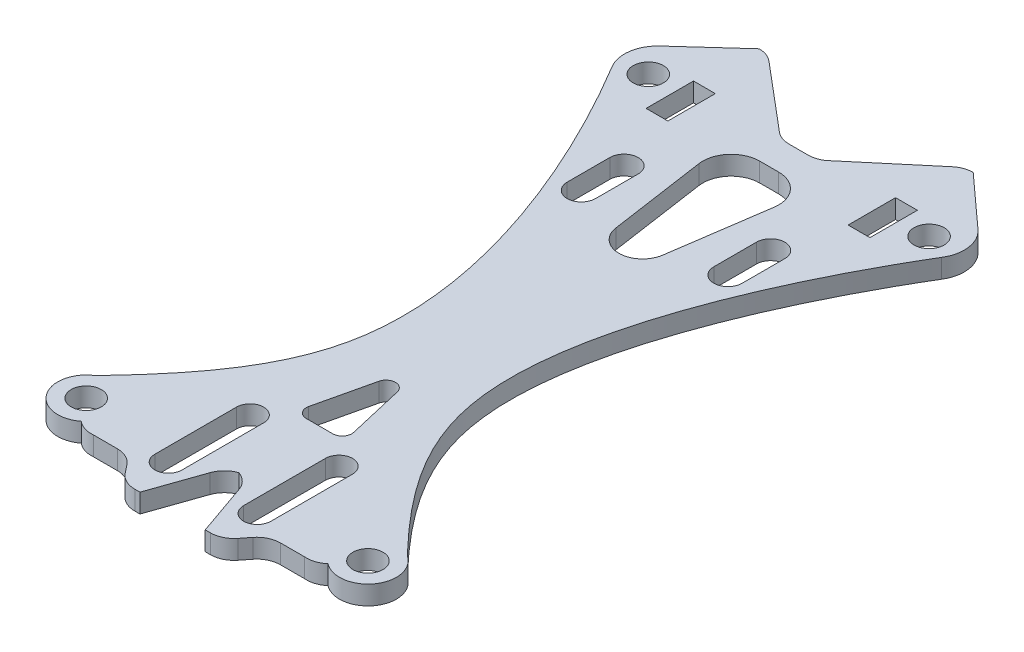
from build123d import *

# Parameters (mm, degrees)
CROQUIS1_R              = 1.5875
CROQUIS1_W              = 2.3
CROQUIS1_H              = 5
SALIENTE_EXTRUIR2_DEPTH = 2


with BuildPart() as part:
    # Croquis1 → Saliente-Extruir2 (new body)
    with BuildSketch(Plane(origin=(0, 0, 0), x_dir=(1, 0, 0), z_dir=(0, 1, 0))):
        with BuildLine():
            Line((-16.762987127, 33.41807474), (-11.286730499, 38.387118929))
            ThreePointArc((-11.286730499, 38.387118929), (-10.420900247, 38.238338665), (-9.659998874, 37.799218302))
            Line((-9.659998874, 37.799218302), (-2.763051086, 31.989574312))
            ThreePointArc((-2.763051086, 31.989574312), (-1.95542878, 31.454802741), (-1.00515352, 31.267155856))
            Line((-1.00515352, 31.267155856), (-0.040723182, 31.267155856))
            Line((-0.040723182, 31.267155856), (0.040723182, 31.267155856))
            Line((0.040723182, 31.267155856), (1.00515352, 31.267155856))
            ThreePointArc((1.00515352, 31.267155856), (1.95542878, 31.454802741), (2.763051086, 31.989574312))
            Line((2.763051086, 31.989574312), (9.659998874, 37.799218302))
            ThreePointArc((9.659998874, 37.799218302), (10.420900247, 38.238338665), (11.286730499, 38.387118929))
            Line((11.286730499, 38.387118929), (16.762987127, 33.41807474))
            ThreePointArc((16.762987127, 33.41807474), (17.879398464, 31.295802238), (17.367697595, 28.953031002))
            add(Edge.make_bspline(
                [(16.468171907, -26.453354129), (11.118055328, -20.880037637), (-0.475190064, -5.25871988), (11.98227146, 19.992839151), (17.367697595, 28.953031002)],
                knots=[0, 0, 0, 0, 0.325398162, 1, 1, 1, 1], degree=3))
            ThreePointArc((16.468171907, -26.453354129), (17.297467492, -30.714428288), (13.002178368, -31.342899047))
            ThreePointArc((13.002178368, -31.342899047), (12.132213174, -31.835753002), (11.138692552, -31.948275137))
            Line((11.138692552, -31.948275137), (8.598739942, -31.948275137))
            ThreePointArc((8.598739942, -31.948275137), (7.506720993, -32.19938772), (6.634077803, -32.902279446))
            Line((6.634077803, -32.902279446), (5.953226574, -33.767509951))
            ThreePointArc((5.953226574, -33.767509951), (5.080583384, -34.470401676), (3.988564435, -34.721514259))
            Line((3.988564435, -34.721514259), (3.441216411, -34.721514259))
            Line((3.441216411, -34.721514259), (1.533856825, -29.262119003))
            ThreePointArc((1.533856825, -29.262119003), (0.942151005, -28.319542636), (0, -27.727159764))
            ThreePointArc((0, -27.727159764), (-0.942151005, -28.319542636), (-1.533856825, -29.262119003))
            Line((-1.533856825, -29.262119003), (-3.441216411, -34.721514259))
            Line((-3.441216411, -34.721514259), (-3.988564435, -34.721514259))
            ThreePointArc((-3.988564435, -34.721514259), (-5.080583384, -34.470401676), (-5.953226574, -33.767509951))
            Line((-5.953226574, -33.767509951), (-6.634077803, -32.902279446))
            ThreePointArc((-6.634077803, -32.902279446), (-7.506720993, -32.19938772), (-8.598739942, -31.948275137))
            Line((-8.598739942, -31.948275137), (-11.138692552, -31.948275137))
            ThreePointArc((-11.138692552, -31.948275137), (-12.132213174, -31.835753002), (-13.002178368, -31.342899047))
            ThreePointArc((-13.002178368, -31.342899047), (-17.297467492, -30.714428288), (-16.468171907, -26.453354129))
            add(Edge.make_bspline(
                [(-16.468171907, -26.453354129), (-11.118055328, -20.880037637), (0.475190064, -5.25871988), (-11.98227146, 19.992839151), (-17.367697595, 28.953031002)],
                knots=[0, 0, 0, 0, 0.325398162, 1, 1, 1, 1], degree=3))
            ThreePointArc((-17.367697595, 28.953031002), (-17.879398464, 31.295802238), (-16.762987127, 33.41807474))
        make_face()
        with Locations((-14.85, -28.979521122)):
            Circle(CROQUIS1_R, mode=Mode.SUBTRACT)
        with Locations((14.85, -28.979521122)):
            Circle(CROQUIS1_R, mode=Mode.SUBTRACT)
        with Locations((-14.8, 30.22394451)):
            Circle(CROQUIS1_R, mode=Mode.SUBTRACT)
        with Locations((14.8, 30.22394451)):
            Circle(CROQUIS1_R, mode=Mode.SUBTRACT)
        with BuildLine():
            Line((-3.249732449, -21.867659367), (-3.249732449, -30.47604675))
            ThreePointArc((-3.249732449, -30.47604675), (-4.684765235, -31.911079536), (-6.119798022, -30.47604675))
            Line((-6.119798022, -30.47604675), (-6.119798022, -21.867659367))
            ThreePointArc((-6.119798022, -21.867659367), (-4.684765235, -20.432626581), (-3.249732449, -21.867659367))
        make_face(mode=Mode.SUBTRACT)
        with BuildLine():
            Line((-1.39382162, -19.231382002), (1.39382162, -19.231382002))
            ThreePointArc((1.39382162, -19.231382002), (2.176853635, -18.853363403), (2.367884319, -18.005103727))
            Line((2.367884319, -18.005103727), (0.974062699, -12.005103727))
            ThreePointArc((0.974062699, -12.005103727), (0, -11.231382002), (-0.974062699, -12.005103727))
            Line((-0.974062699, -12.005103727), (-2.367884319, -18.005103727))
            ThreePointArc((-2.367884319, -18.005103727), (-2.176853635, -18.853363403), (-1.39382162, -19.231382002))
        make_face(mode=Mode.SUBTRACT)
        with BuildLine():
            Line((-6.229263844, 20.592791948), (-6.229263844, 16.095612647))
            ThreePointArc((-6.229263844, 16.095612647), (-7.728593009, 14.596283481), (-9.227922175, 16.095612647))
            Line((-9.227922175, 16.095612647), (-9.227922175, 20.592791948))
            ThreePointArc((-9.227922175, 20.592791948), (-7.728593009, 22.092121114), (-6.229263844, 20.592791948))
        make_face(mode=Mode.SUBTRACT)
        with BuildLine():
            Line((3.249732449, -21.867659367), (3.249732449, -30.47604675))
            ThreePointArc((3.249732449, -30.47604675), (4.684765235, -31.911079536), (6.119798022, -30.47604675))
            Line((6.119798022, -30.47604675), (6.119798022, -21.867659367))
            ThreePointArc((6.119798022, -21.867659367), (4.684765235, -20.432626581), (3.249732449, -21.867659367))
        make_face(mode=Mode.SUBTRACT)
        with BuildLine():
            Line((6.229263844, 20.592791948), (6.229263844, 16.095612647))
            ThreePointArc((6.229263844, 16.095612647), (7.728593009, 14.596283481), (9.227922175, 16.095612647))
            Line((9.227922175, 16.095612647), (9.227922175, 20.592791948))
            ThreePointArc((9.227922175, 20.592791948), (7.728593009, 22.092121114), (6.229263844, 20.592791948))
        make_face(mode=Mode.SUBTRACT)
        with BuildLine():
            Line((-1.001806653, 28.16717115), (1.001806653, 28.16717115))
            ThreePointArc((1.001806653, 28.16717115), (3.270984433, 27.12952489), (3.970426322, 24.734392618))
            Line((3.970426322, 24.734392618), (2.473849725, 14.468710767))
            ThreePointArc((2.473849725, 14.468710767), (0, 12.329359543), (-2.473849725, 14.468710767))
            Line((-2.473849725, 14.468710767), (-3.970426322, 24.734392618))
            ThreePointArc((-3.970426322, 24.734392618), (-3.270984433, 27.12952489), (-1.001806653, 28.16717115))
        make_face(mode=Mode.SUBTRACT)
        with Locations((-10.65, 29.489574312)):
            Rectangle(CROQUIS1_W, CROQUIS1_H, mode=Mode.SUBTRACT)
        with Locations((10.65, 29.489574312)):
            Rectangle(CROQUIS1_W, CROQUIS1_H, mode=Mode.SUBTRACT)
    extrude(amount=SALIENTE_EXTRUIR2_DEPTH)


solid = part.part
